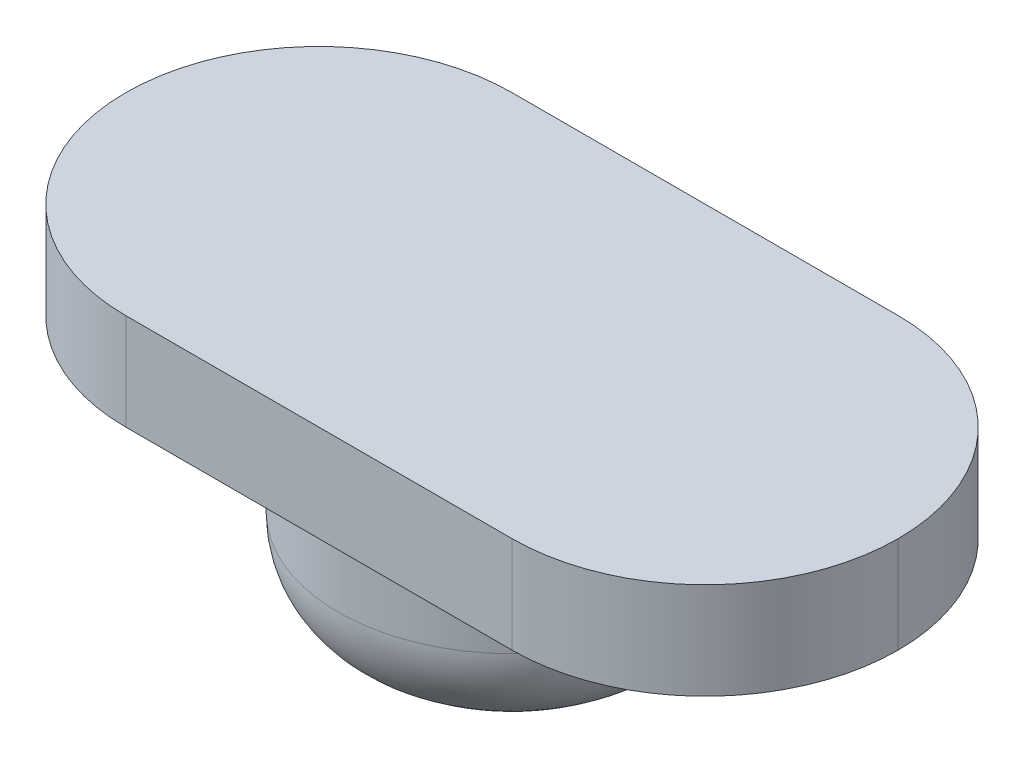
from build123d import *

# Parameters (mm, degrees)
SKETCH2_W           = 20
SKETCH2_H           = 10
BOSS_EXTRUDE1_DEPTH = 2.5
FILLET1_R           = 5
SKETCH3_R           = 4.5
BOSS_EXTRUDE2_DEPTH = 4.4
FILLET2_R           = 2.5


with BuildPart() as part:
    # Sketch2 → Boss-Extrude1 (new body)
    with BuildSketch(Plane.XZ):
        with Locations((0, -40)):
            Rectangle(SKETCH2_W, SKETCH2_H)
    extrude(amount=BOSS_EXTRUDE1_DEPTH)

    # Fillet1
    fillet1_edges = [part.edges().sort_by_distance(p)[0] for p in [
        (-10, -1.25, -35),
        (-10, -1.25, -45),
        (10, -1.25, -45),
        (10, -1.25, -35),
    ]]
    fillet(fillet1_edges, radius=FILLET1_R - 0.0001)  # a hair under: the kernel refuses the full size

    # Sketch3 → Boss-Extrude2 (add)
    with BuildSketch(Plane.XZ.offset(2.5)):
        with Locations(Location((0, -40, 0), (0, 0, 270))):
            Circle(SKETCH3_R)
    extrude(amount=BOSS_EXTRUDE2_DEPTH)

    # Fillet2
    fillet2_edges = [part.edges().sort_by_distance(p)[0] for p in [
        (0, -6.9, -35.5),
    ]]
    fillet(fillet2_edges, radius=FILLET2_R)


solid = part.part
